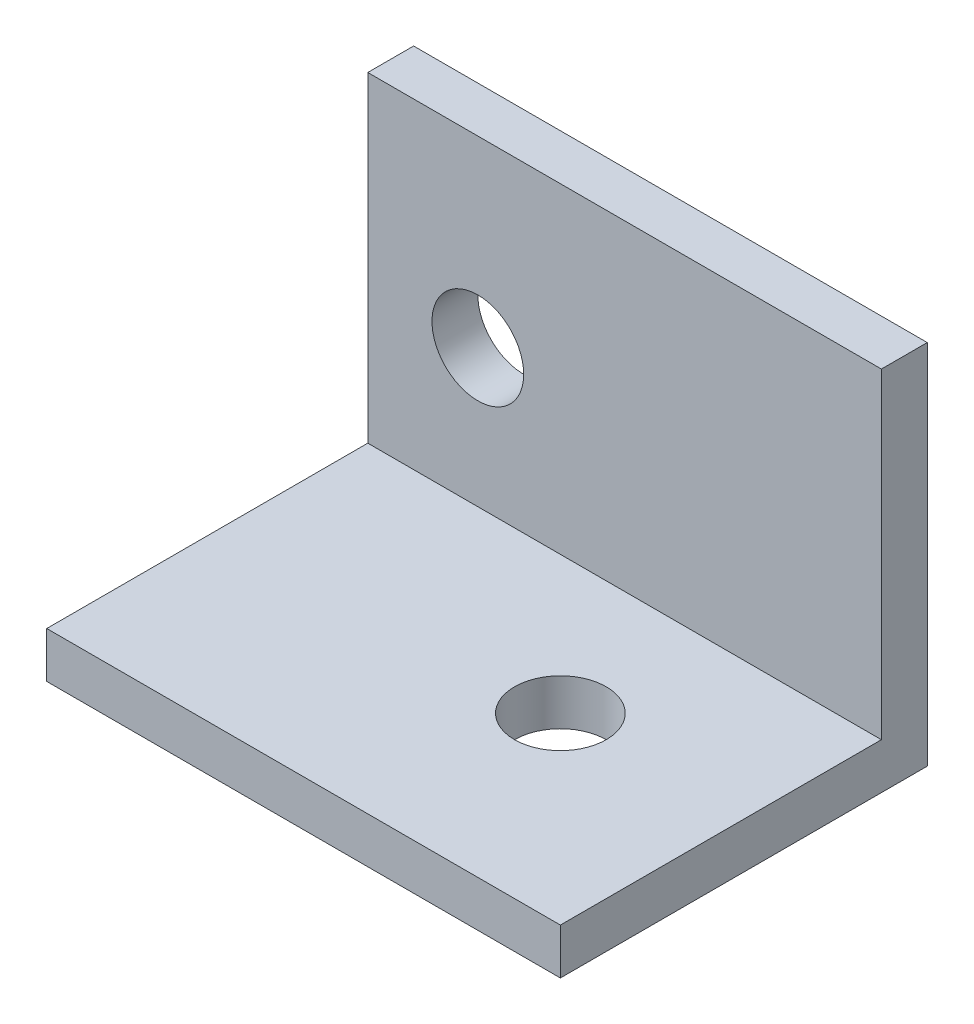
from build123d import *

# Parameters (mm, degrees)
SKETCH1_W           = 35.56
SKETCH1_H           = 25.4
BOSS_EXTRUDE1_DEPTH = 3.175
SKETCH2_W           = 35.56
SKETCH2_H           = 3.175
BOSS_EXTRUDE2_DEPTH = 22.225
SKETCH3_R           = 3.175
CUT_EXTRUDE1_DEPTH  = 3.175
SKETCH4_R           = 3.175
CUT_EXTRUDE2_DEPTH  = 3.175


with BuildPart() as part:
    # Sketch1 → Boss-Extrude1 (new body)
    with BuildSketch(Plane(origin=(0, 0, 0), x_dir=(1, 0, 0), z_dir=(0, 1, 0))):
        Rectangle(SKETCH1_W, SKETCH1_H)
    extrude(amount=BOSS_EXTRUDE1_DEPTH)

    # Sketch2 → Boss-Extrude2 (add)
    with BuildSketch(Plane(origin=(0, 3.175, 0), x_dir=(1, 0, 0), z_dir=(0, 1, 0))):
        with Locations((0, 11.1125)):
            Rectangle(SKETCH2_W, SKETCH2_H)
    extrude(amount=BOSS_EXTRUDE2_DEPTH)

    # Sketch3 → Cut-Extrude1 (cut)
    with BuildSketch(Plane(origin=(0, 3.175, 0), x_dir=(1, 0, 0), z_dir=(0, 1, 0))):
        with Locations((5.08, 0)):
            Circle(SKETCH3_R)
    extrude(amount=-CUT_EXTRUDE1_DEPTH, mode=Mode.SUBTRACT)

    # Sketch4 → Cut-Extrude2 (cut)
    with BuildSketch(Plane.XY.offset(-9.525)):
        with Locations((-10.16, 12.7)):
            Circle(SKETCH4_R)
    extrude(amount=-CUT_EXTRUDE2_DEPTH, mode=Mode.SUBTRACT)


solid = part.part
